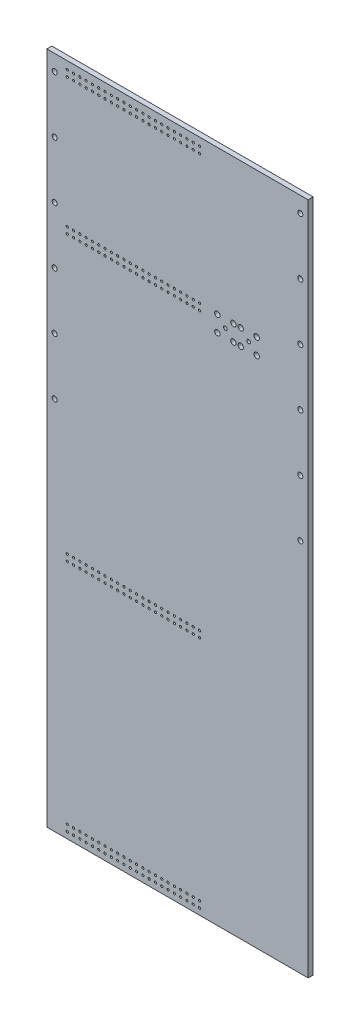
from build123d import *

# Parameters (mm, degrees)
SKETCH1_W                 = 83
SKETCH1_H                 = 214
BOSS_EXTRUDE1_DEPTH       = 1.5875
F_0_CLEARANCE_HOLE1_D     = 1.6129
F_0_CLEARANCE_HOLE1_DEPTH = 3.175
F_0_CLEARANCE_HOLE1_TIP   = 0.484564046
SKETCH6_W                 = 72.5
SKETCH6_H                 = 7
BOSS_EXTRUDE3_DEPTH       = 4.9125
SKETCH7_R                 = 0.35
SKETCH7_R_2               = 0.5842
SKETCH7_R_3               = 0.8509
CUT_EXTRUDE1_DEPTH        = 115.949989126


with BuildPart() as part:
    # Sketch1 → Boss-Extrude1 (new body)
    with BuildSketch(Plane.XY):
        Rectangle(SKETCH1_W, SKETCH1_H)
    extrude(amount=BOSS_EXTRUDE1_DEPTH)

    # #0 Clearance Hole1
    with Locations(Plane.XY.offset(1.5875)):
        with Locations((-39, 102), (39, 102), (39, 84), (39, 66), (39, 48), (39, 30), (39, 12), (-39, 84), (-39, 66), (-39, 48), (-39, 30), (-39, 12)):
            Hole(F_0_CLEARANCE_HOLE1_D / 2, depth=F_0_CLEARANCE_HOLE1_DEPTH)
            with Locations((0, 0, -(F_0_CLEARANCE_HOLE1_DEPTH + F_0_CLEARANCE_HOLE1_TIP / 2))):  # 118° drill point
                Cone(0, F_0_CLEARANCE_HOLE1_D / 2, F_0_CLEARANCE_HOLE1_TIP, mode=Mode.SUBTRACT)

    # Sketch6 → Boss-Extrude3 (add)
    with BuildSketch(Plane(origin=(0, 0, 0), x_dir=(-1, 0, 0), z_dir=(0, 0, -1))):
        with Locations((0.05, -3.5)):
            Rectangle(SKETCH6_W, SKETCH6_H)
    extrude(amount=BOSS_EXTRUDE3_DEPTH)

    # Sketch7 → Cut-Extrude1 (cut, through all)
    with BuildSketch(Plane.XY.offset(1.5875)):
        with Locations((-35, 102.5)):
            Circle(SKETCH7_R)
        with Locations((-33, 102.5)):
            Circle(SKETCH7_R)
        with Locations((-31, 102.5)):
            Circle(SKETCH7_R)
        with Locations((-29, 102.5)):
            Circle(SKETCH7_R)
        with Locations((-27, 102.5)):
            Circle(SKETCH7_R)
        with Locations((-25, 102.5)):
            Circle(SKETCH7_R)
        with Locations((-23, 102.5)):
            Circle(SKETCH7_R)
        with Locations((-21, 102.5)):
            Circle(SKETCH7_R)
        with Locations((-19, 102.5)):
            Circle(SKETCH7_R)
        with Locations((-17, 102.5)):
            Circle(SKETCH7_R)
        with Locations((-15, 102.5)):
            Circle(SKETCH7_R)
        with Locations((-13, 102.5)):
            Circle(SKETCH7_R)
        with Locations((-11, 102.5)):
            Circle(SKETCH7_R)
        with Locations((-9, 102.5)):
            Circle(SKETCH7_R)
        with Locations((-7, 102.5)):
            Circle(SKETCH7_R)
        with Locations((-5, 102.5)):
            Circle(SKETCH7_R)
        with Locations((-3, 102.5)):
            Circle(SKETCH7_R)
        with Locations((-1, 102.5)):
            Circle(SKETCH7_R)
        with Locations((1, 102.5)):
            Circle(SKETCH7_R)
        with Locations((3, 102.5)):
            Circle(SKETCH7_R)
        with Locations((5, 102.5)):
            Circle(SKETCH7_R)
        with Locations((7, 102.5)):
            Circle(SKETCH7_R)
        with Locations((-33, 104.5)):
            Circle(SKETCH7_R)
        with Locations((-31, 104.5)):
            Circle(SKETCH7_R)
        with Locations((-29, 104.5)):
            Circle(SKETCH7_R)
        with Locations((-27, 104.5)):
            Circle(SKETCH7_R)
        with Locations((-25, 104.5)):
            Circle(SKETCH7_R)
        with Locations((-23, 104.5)):
            Circle(SKETCH7_R)
        with Locations((-21, 104.5)):
            Circle(SKETCH7_R)
        with Locations((-19, 104.5)):
            Circle(SKETCH7_R)
        with Locations((-17, 104.5)):
            Circle(SKETCH7_R)
        with Locations((-15, 104.5)):
            Circle(SKETCH7_R)
        with Locations((-13, 104.5)):
            Circle(SKETCH7_R)
        with Locations((-11, 104.5)):
            Circle(SKETCH7_R)
        with Locations((-9, 104.5)):
            Circle(SKETCH7_R)
        with Locations((-7, 104.5)):
            Circle(SKETCH7_R)
        with Locations((-5, 104.5)):
            Circle(SKETCH7_R)
        with Locations((-3, 104.5)):
            Circle(SKETCH7_R)
        with Locations((-1, 104.5)):
            Circle(SKETCH7_R)
        with Locations((1, 104.5)):
            Circle(SKETCH7_R)
        with Locations((3, 104.5)):
            Circle(SKETCH7_R)
        with Locations((5, 104.5)):
            Circle(SKETCH7_R)
        with Locations((7, 104.5)):
            Circle(SKETCH7_R)
        with Locations((-35, 104.5)):
            Circle(SKETCH7_R)
        with Locations((-35, 59.325)):
            Circle(SKETCH7_R)
        with Locations((-33, 59.325)):
            Circle(SKETCH7_R)
        with Locations((-31, 59.325)):
            Circle(SKETCH7_R)
        with Locations((-29, 59.325)):
            Circle(SKETCH7_R)
        with Locations((-27, 59.325)):
            Circle(SKETCH7_R)
        with Locations((-25, 59.325)):
            Circle(SKETCH7_R)
        with Locations((-23, 59.325)):
            Circle(SKETCH7_R)
        with Locations((-21, 59.325)):
            Circle(SKETCH7_R)
        with Locations((-19, 59.325)):
            Circle(SKETCH7_R)
        with Locations((-17, 59.325)):
            Circle(SKETCH7_R)
        with Locations((-15, 59.325)):
            Circle(SKETCH7_R)
        with Locations((-13, 59.325)):
            Circle(SKETCH7_R)
        with Locations((-11, 59.325)):
            Circle(SKETCH7_R)
        with Locations((-9, 59.325)):
            Circle(SKETCH7_R)
        with Locations((-7, 59.325)):
            Circle(SKETCH7_R)
        with Locations((-5, 59.325)):
            Circle(SKETCH7_R)
        with Locations((-3, 59.325)):
            Circle(SKETCH7_R)
        with Locations((-1, 59.325)):
            Circle(SKETCH7_R)
        with Locations((1, 59.325)):
            Circle(SKETCH7_R)
        with Locations((3, 59.325)):
            Circle(SKETCH7_R)
        with Locations((5, 59.325)):
            Circle(SKETCH7_R)
        with Locations((7, 59.325)):
            Circle(SKETCH7_R)
        with Locations((-33, 61.325)):
            Circle(SKETCH7_R)
        with Locations((-31, 61.325)):
            Circle(SKETCH7_R)
        with Locations((-29, 61.325)):
            Circle(SKETCH7_R)
        with Locations((-27, 61.325)):
            Circle(SKETCH7_R)
        with Locations((-25, 61.325)):
            Circle(SKETCH7_R)
        with Locations((-23, 61.325)):
            Circle(SKETCH7_R)
        with Locations((-21, 61.325)):
            Circle(SKETCH7_R)
        with Locations((-19, 61.325)):
            Circle(SKETCH7_R)
        with Locations((-17, 61.325)):
            Circle(SKETCH7_R)
        with Locations((-15, 61.325)):
            Circle(SKETCH7_R)
        with Locations((-13, 61.325)):
            Circle(SKETCH7_R)
        with Locations((-11, 61.325)):
            Circle(SKETCH7_R)
        with Locations((-9, 61.325)):
            Circle(SKETCH7_R)
        with Locations((-7, 61.325)):
            Circle(SKETCH7_R)
        with Locations((-5, 61.325)):
            Circle(SKETCH7_R)
        with Locations((-3, 61.325)):
            Circle(SKETCH7_R)
        with Locations((-1, 61.325)):
            Circle(SKETCH7_R)
        with Locations((1, 61.325)):
            Circle(SKETCH7_R)
        with Locations((3, 61.325)):
            Circle(SKETCH7_R)
        with Locations((5, 61.325)):
            Circle(SKETCH7_R)
        with Locations((7, 61.325)):
            Circle(SKETCH7_R)
        with Locations((-35, 61.325)):
            Circle(SKETCH7_R)
        with Locations((15.2, 58.565)):
            Circle(SKETCH7_R_2)
        with Locations((12.66, 61.105)):
            Circle(SKETCH7_R_3)
        with Locations((17.74, 61.105)):
            Circle(SKETCH7_R_3)
        with Locations((17.74, 56.025)):
            Circle(SKETCH7_R_3)
        with Locations((12.66, 56.025)):
            Circle(SKETCH7_R_3)
        with Locations((-35, -30.675)):
            Circle(SKETCH7_R)
        with Locations((-33, -30.675)):
            Circle(SKETCH7_R)
        with Locations((-31, -30.675)):
            Circle(SKETCH7_R)
        with Locations((-29, -30.675)):
            Circle(SKETCH7_R)
        with Locations((-27, -30.675)):
            Circle(SKETCH7_R)
        with Locations((-25, -30.675)):
            Circle(SKETCH7_R)
        with Locations((-23, -30.675)):
            Circle(SKETCH7_R)
        with Locations((-21, -30.675)):
            Circle(SKETCH7_R)
        with Locations((-19, -30.675)):
            Circle(SKETCH7_R)
        with Locations((-17, -30.675)):
            Circle(SKETCH7_R)
        with Locations((-15, -30.675)):
            Circle(SKETCH7_R)
        with Locations((-13, -30.675)):
            Circle(SKETCH7_R)
        with Locations((-11, -30.675)):
            Circle(SKETCH7_R)
        with Locations((-9, -30.675)):
            Circle(SKETCH7_R)
        with Locations((-7, -30.675)):
            Circle(SKETCH7_R)
        with Locations((-5, -30.675)):
            Circle(SKETCH7_R)
        with Locations((-3, -30.675)):
            Circle(SKETCH7_R)
        with Locations((-1, -30.675)):
            Circle(SKETCH7_R)
        with Locations((1, -30.675)):
            Circle(SKETCH7_R)
        with Locations((3, -30.675)):
            Circle(SKETCH7_R)
        with Locations((5, -30.675)):
            Circle(SKETCH7_R)
        with Locations((7, -30.675)):
            Circle(SKETCH7_R)
        with Locations((-33, -28.675)):
            Circle(SKETCH7_R)
        with Locations((-31, -28.675)):
            Circle(SKETCH7_R)
        with Locations((-29, -28.675)):
            Circle(SKETCH7_R)
        with Locations((-27, -28.675)):
            Circle(SKETCH7_R)
        with Locations((-25, -28.675)):
            Circle(SKETCH7_R)
        with Locations((-23, -28.675)):
            Circle(SKETCH7_R)
        with Locations((-21, -28.675)):
            Circle(SKETCH7_R)
        with Locations((-19, -28.675)):
            Circle(SKETCH7_R)
        with Locations((-17, -28.675)):
            Circle(SKETCH7_R)
        with Locations((-15, -28.675)):
            Circle(SKETCH7_R)
        with Locations((-13, -28.675)):
            Circle(SKETCH7_R)
        with Locations((-11, -28.675)):
            Circle(SKETCH7_R)
        with Locations((-9, -28.675)):
            Circle(SKETCH7_R)
        with Locations((-7, -28.675)):
            Circle(SKETCH7_R)
        with Locations((-5, -28.675)):
            Circle(SKETCH7_R)
        with Locations((-3, -28.675)):
            Circle(SKETCH7_R)
        with Locations((-1, -28.675)):
            Circle(SKETCH7_R)
        with Locations((1, -28.675)):
            Circle(SKETCH7_R)
        with Locations((3, -28.675)):
            Circle(SKETCH7_R)
        with Locations((5, -28.675)):
            Circle(SKETCH7_R)
        with Locations((7, -28.675)):
            Circle(SKETCH7_R)
        with Locations((-35, -28.675)):
            Circle(SKETCH7_R)
        with Locations((-35, -105)):
            Circle(SKETCH7_R)
        with Locations((-33, -105)):
            Circle(SKETCH7_R)
        with Locations((-31, -105)):
            Circle(SKETCH7_R)
        with Locations((-29, -105)):
            Circle(SKETCH7_R)
        with Locations((-27, -105)):
            Circle(SKETCH7_R)
        with Locations((-25, -105)):
            Circle(SKETCH7_R)
        with Locations((-23, -105)):
            Circle(SKETCH7_R)
        with Locations((-21, -105)):
            Circle(SKETCH7_R)
        with Locations((-19, -105)):
            Circle(SKETCH7_R)
        with Locations((-17, -105)):
            Circle(SKETCH7_R)
        with Locations((-15, -105)):
            Circle(SKETCH7_R)
        with Locations((-13, -105)):
            Circle(SKETCH7_R)
        with Locations((-11, -105)):
            Circle(SKETCH7_R)
        with Locations((-9, -105)):
            Circle(SKETCH7_R)
        with Locations((-7, -105)):
            Circle(SKETCH7_R)
        with Locations((-5, -105)):
            Circle(SKETCH7_R)
        with Locations((-3, -105)):
            Circle(SKETCH7_R)
        with Locations((-1, -105)):
            Circle(SKETCH7_R)
        with Locations((1, -105)):
            Circle(SKETCH7_R)
        with Locations((3, -105)):
            Circle(SKETCH7_R)
        with Locations((5, -105)):
            Circle(SKETCH7_R)
        with Locations((7, -105)):
            Circle(SKETCH7_R)
        with Locations((-33, -103)):
            Circle(SKETCH7_R)
        with Locations((-31, -103)):
            Circle(SKETCH7_R)
        with Locations((-29, -103)):
            Circle(SKETCH7_R)
        with Locations((-27, -103)):
            Circle(SKETCH7_R)
        with Locations((-25, -103)):
            Circle(SKETCH7_R)
        with Locations((-23, -103)):
            Circle(SKETCH7_R)
        with Locations((-21, -103)):
            Circle(SKETCH7_R)
        with Locations((-19, -103)):
            Circle(SKETCH7_R)
        with Locations((-17, -103)):
            Circle(SKETCH7_R)
        with Locations((-15, -103)):
            Circle(SKETCH7_R)
        with Locations((-13, -103)):
            Circle(SKETCH7_R)
        with Locations((-11, -103)):
            Circle(SKETCH7_R)
        with Locations((-9, -103)):
            Circle(SKETCH7_R)
        with Locations((-7, -103)):
            Circle(SKETCH7_R)
        with Locations((-5, -103)):
            Circle(SKETCH7_R)
        with Locations((-3, -103)):
            Circle(SKETCH7_R)
        with Locations((-1, -103)):
            Circle(SKETCH7_R)
        with Locations((1, -103)):
            Circle(SKETCH7_R)
        with Locations((3, -103)):
            Circle(SKETCH7_R)
        with Locations((5, -103)):
            Circle(SKETCH7_R)
        with Locations((7, -103)):
            Circle(SKETCH7_R)
        with Locations((-35, -103)):
            Circle(SKETCH7_R)
        with Locations((22.6, 58.565)):
            Circle(SKETCH7_R_2)
        with Locations((20.06, 61.105)):
            Circle(SKETCH7_R_3)
        with Locations((25.14, 61.105)):
            Circle(SKETCH7_R_3)
        with Locations((25.14, 56.025)):
            Circle(SKETCH7_R_3)
        with Locations((20.06, 56.025)):
            Circle(SKETCH7_R_3)
    extrude(amount=-CUT_EXTRUDE1_DEPTH, mode=Mode.SUBTRACT)


solid = part.part
